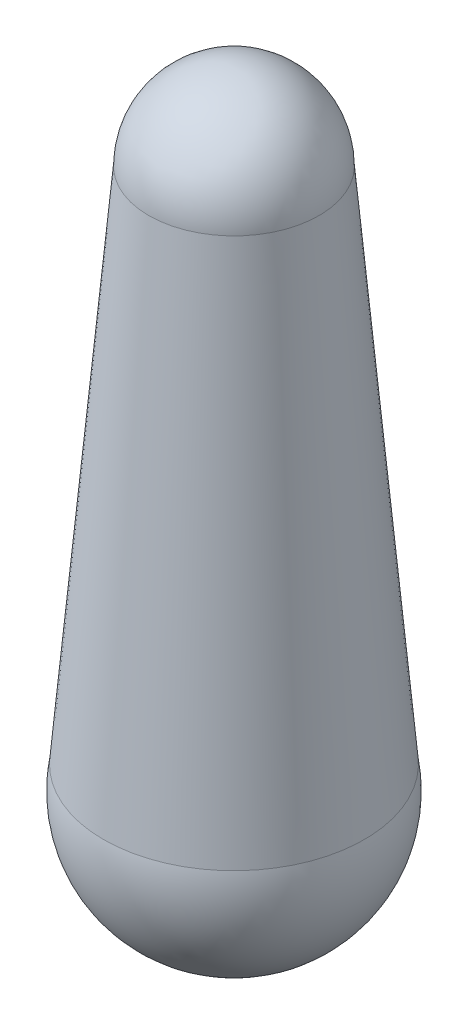
from build123d import *

# Parameters (mm, degrees)
SKETCH2_R           = 2.45
BOSS_EXTRUDE1_DEPTH = 10
BOSS_EXTRUDE1_TAPER = 5


with BuildPart() as part:
    # Sketch1 → Revolve1 (revolve)
    with BuildSketch(Plane(origin=(0, 0, 0), x_dir=(1, 0, 0), z_dir=(0, 1, 0))):
        with BuildLine():
            Line((0, 2.45), (0, -2.45))
            ThreePointArc((0, -2.45), (2.45, 0), (0, 2.45))
        make_face()
    revolve(axis=Axis((0, 0, -2.45), (0, 0, 1)))

    # Sketch2 → Boss-Extrude1 (add)
    with BuildSketch(Plane(origin=(0, 0, 0), x_dir=(1, 0, 0), z_dir=(0, 1, 0))):
        Circle(SKETCH2_R)
    extrude(amount=BOSS_EXTRUDE1_DEPTH, taper=BOSS_EXTRUDE1_TAPER)

    # Sketch3 → Revolve2 (revolve)
    with BuildSketch(Plane(origin=(0, 10, 0), x_dir=(1, 0, 0), z_dir=(0, 1, 0))):
        with BuildLine():
            Line((0, 1.575113365), (0, -1.575113365))
            ThreePointArc((0, -1.575113365), (1.575113365, 0), (0, 1.575113365))
        make_face()
    revolve(axis=Axis((0, 10, -1.575113365), (0, 0, 1)))


solid = part.part
